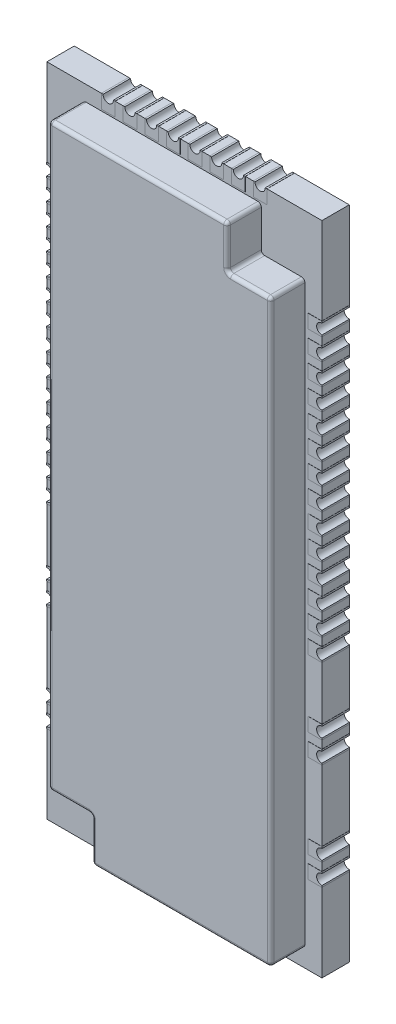
from build123d import *

# Parameters (mm, degrees)
ESQUISSE1_W                          = 16.1
ESQUISSE1_H                          = 38.4
BOSS_EXTRU_1_DEPTH                   = 1.6
ESQUISSE7_W                          = 0.8
ESQUISSE7_H                          = 0.8
BOSS_EXTRU_4_DEPTH                   = 0.01
ESQUISSE9_W                          = 0.8
ESQUISSE9_H                          = 0.8
BOSS_EXTRU_6_DEPTH                   = 0.01
R_P_TITION_LIN_AIRE6_COUNT           = 8
R_P_TITION_LIN_AIRE6_PITCH           = 1.27
R_P_TITION_LIN_AIRE4_COUNT           = 14
R_P_TITION_LIN_AIRE4_PITCH           = 1.27
R_P_TITION_LIN_AIRE4_COUNT_DIR2      = 2
R_P_TITION_LIN_AIRE4_PITCH_DIR2      = 15.3
ESQUISSE10_W                         = 0.800196755
ESQUISSE10_H                         = 1.574838598
BOSS_EXTRU_7_DEPTH                   = 0.01
R_P_TITION_LIN_AIRE7_COUNT           = 8
R_P_TITION_LIN_AIRE7_PITCH           = 1.27
ESQUISSE8_W                          = 1.61
ESQUISSE8_H                          = 0.799843022
BOSS_EXTRU_5_DEPTH                   = 0.01
R_P_TITION_LIN_AIRE5_COUNT           = 14
R_P_TITION_LIN_AIRE5_PITCH           = 1.27
R_P_TITION_LIN_AIRE5_COUNT_DIR2      = 2
R_P_TITION_LIN_AIRE5_PITCH_DIR2      = 16.11
ESQUISSE11_W                         = 0.8
ESQUISSE11_H                         = 0.8
BOSS_EXTRU_8_DEPTH                   = 0.01
ESQUISSE12_W                         = 1.61
ESQUISSE12_H                         = 0.8
BOSS_EXTRU_9_DEPTH                   = 0.01
R_P_TITION_LIN_AIRE8_COUNT           = 2
R_P_TITION_LIN_AIRE8_PITCH           = 1.27
R_P_TITION_LIN_AIRE8_COUNT_DIR2      = 2
R_P_TITION_LIN_AIRE8_PITCH_DIR2      = 16.11
R_P_TITION_LIN_AIRE9_COPY_1_SKETCH_W = 1.61
R_P_TITION_LIN_AIRE9_COPY_1_SKETCH_H = 0.8
R_P_TITION_LIN_AIRE9_COPY_1_DEPTH    = 0.01
R_P_TITION_LIN_AIRE9_COPY_2_SKETCH_W = 1.61
R_P_TITION_LIN_AIRE9_COPY_2_SKETCH_H = 0.8
R_P_TITION_LIN_AIRE9_COPY_2_DEPTH    = 0.01
R_P_TITION_LIN_AIRE9_COPY_3_SKETCH_W = 1.61
R_P_TITION_LIN_AIRE9_COPY_3_SKETCH_H = 0.8
R_P_TITION_LIN_AIRE9_COPY_3_DEPTH    = 0.01
R_P_TITION_LIN_AIRE9_COPY_4_SKETCH_W = 1.61
R_P_TITION_LIN_AIRE9_COPY_4_SKETCH_H = 0.8
R_P_TITION_LIN_AIRE9_COPY_4_DEPTH    = 0.01
ENL_V_START                          = -1.6
ESQUISSE2_R                          = 0.3
ENL_V_MAT_EXTRU_1_DEPTH              = 1.7
R_P_TITION_LIN_AIRE10_COUNT          = 2
R_P_TITION_LIN_AIRE10_PITCH          = 15.3
R_P_TITION_LIN_AIRE1_COUNT           = 14
R_P_TITION_LIN_AIRE1_PITCH           = 16.1
ESQUISSE3_R                          = 0.3
ENL_V_MAT_EXTRU_2_DEPTH              = 1.7
R_P_TITION_LIN_AIRE2_COUNT           = 2
R_P_TITION_LIN_AIRE2_PITCH           = 16.1
R_P_TITION_LIN_AIRE2_COUNT_DIR2      = 14
R_P_TITION_LIN_AIRE2_PITCH_DIR2      = 1.27
ESQUISSE4_R                          = 0.3
ENL_V_MAT_EXTRU_3_DEPTH              = 1.7
R_P_TITION_LIN_AIRE3_COUNT           = 8
R_P_TITION_LIN_AIRE3_PITCH           = 1.27
ESQUISSE5_W                          = 13
ESQUISSE5_H                          = 36.5
BOSS_EXTRU_2_DEPTH                   = 2
ESQUISSE6_W                          = 2.55
ESQUISSE6_H                          = 2.55
ENL_V_MAT_EXTRU_4_DEPTH              = 2
CONG_1_R                             = 0.2


with BuildPart() as part:
    # Esquisse1 → Boss.-Extru.1 (new body)
    with BuildSketch(Plane.XY):
        with Locations((8.05, 19.2)):
            Rectangle(ESQUISSE1_W, ESQUISSE1_H)
    extrude(amount=BOSS_EXTRU_1_DEPTH)

    # Esquisse7 → Boss.-Extru.4 (add)
    with BuildSketch(Plane.XY.offset(1.6)):
        with Locations((15.7, 32.91)):
            Rectangle(ESQUISSE7_W, ESQUISSE7_H)
    boss_extru_4 = extrude(amount=BOSS_EXTRU_4_DEPTH)

    # Esquisse9 → Boss.-Extru.6 (add)
    with BuildSketch(Plane.XY.offset(1.6)):
        with Locations((12.49, 38)):
            Rectangle(ESQUISSE9_W, ESQUISSE9_H)
    boss_extru_6 = extrude(amount=BOSS_EXTRU_6_DEPTH)

    # Répétition linéaire6: Boss.-Extru.6 ×8
    with Locations(*[(-i * R_P_TITION_LIN_AIRE6_PITCH, 0, 0) for i in range(1, R_P_TITION_LIN_AIRE6_COUNT)]):
        add(boss_extru_6)

    # Répétition linéaire4: Boss.-Extru.4 14 × 2
    with Locations(*[(-j * R_P_TITION_LIN_AIRE4_PITCH_DIR2, -i * R_P_TITION_LIN_AIRE4_PITCH, 0) for i in range(R_P_TITION_LIN_AIRE4_COUNT) for j in range(R_P_TITION_LIN_AIRE4_COUNT_DIR2) if (i, j) != (0, 0)]):
        add(boss_extru_4)

    # Esquisse10 → Boss.-Extru.7 (add)
    with BuildSketch(Plane(origin=(0, 38.4, 0), x_dir=(1, 0, 0), z_dir=(0, 1, 0))):
        with Locations((12.489901622, -0.822580701)):
            Rectangle(ESQUISSE10_W, ESQUISSE10_H)
    boss_extru_7 = extrude(amount=BOSS_EXTRU_7_DEPTH)

    # Répétition linéaire7: Boss.-Extru.7 ×8
    with Locations(*[(-i * R_P_TITION_LIN_AIRE7_PITCH, 0, 0) for i in range(1, R_P_TITION_LIN_AIRE7_COUNT)]):
        add(boss_extru_7)

    # Esquisse8 → Boss.-Extru.5 (add)
    with BuildSketch(Plane.ZY):
        with Locations((0.805, 32.910078489)):
            Rectangle(ESQUISSE8_W, ESQUISSE8_H)
    boss_extru_5 = extrude(amount=BOSS_EXTRU_5_DEPTH)

    # Répétition linéaire5: Boss.-Extru.5 14 × 2
    with Locations(*[(j * R_P_TITION_LIN_AIRE5_PITCH_DIR2, -i * R_P_TITION_LIN_AIRE5_PITCH, 0) for i in range(R_P_TITION_LIN_AIRE5_COUNT) for j in range(R_P_TITION_LIN_AIRE5_COUNT_DIR2) if (i, j) != (0, 0)]):
        add(boss_extru_5)

    # Esquisse11 → Boss.-Extru.8 (add)
    with BuildSketch(Plane.XY.offset(1.6)):
        with Locations((0.4, 12.47)):
            Rectangle(ESQUISSE11_W, ESQUISSE11_H)
        with Locations((0.4, 11.2)):
            Rectangle(ESQUISSE11_W, ESQUISSE11_H)
        with Locations((0.4, 6.27)):
            Rectangle(ESQUISSE11_W, ESQUISSE11_H)
        with Locations((0.4, 5)):
            Rectangle(ESQUISSE11_W, ESQUISSE11_H)
    boss_extru_8 = extrude(amount=BOSS_EXTRU_8_DEPTH)

    # Esquisse12 → Boss.-Extru.9 (add)
    with BuildSketch(Plane.ZY):
        with Locations((0.805, 12.47)):
            Rectangle(ESQUISSE12_W, ESQUISSE12_H)
    boss_extru_9 = extrude(amount=BOSS_EXTRU_9_DEPTH)

    # Répétition linéaire8: Boss.-Extru.9 2 × 2
    with Locations(*[(j * R_P_TITION_LIN_AIRE8_PITCH_DIR2, -i * R_P_TITION_LIN_AIRE8_PITCH, 0) for i in range(R_P_TITION_LIN_AIRE8_COUNT) for j in range(R_P_TITION_LIN_AIRE8_COUNT_DIR2) if (i, j) != (0, 0)]):
        add(boss_extru_9)

    # Répétition linéaire9 copy 1 sketch → Répétition linéaire9 copy 1 (add)
    with BuildSketch(Plane(origin=(16.11, -6.2, 0), x_dir=(0, 0, 1), z_dir=(-1, 0, 0))):
        with Locations((0.805, 12.47)):
            Rectangle(R_P_TITION_LIN_AIRE9_COPY_1_SKETCH_W, R_P_TITION_LIN_AIRE9_COPY_1_SKETCH_H)
    extrude(amount=R_P_TITION_LIN_AIRE9_COPY_1_DEPTH)

    # Répétition linéaire9 copy 2 sketch → Répétition linéaire9 copy 2 (add)
    with BuildSketch(Plane(origin=(0, -7.47, 0), x_dir=(0, 0, 1), z_dir=(-1, 0, 0))):
        with Locations((0.805, 12.47)):
            Rectangle(R_P_TITION_LIN_AIRE9_COPY_2_SKETCH_W, R_P_TITION_LIN_AIRE9_COPY_2_SKETCH_H)
    extrude(amount=R_P_TITION_LIN_AIRE9_COPY_2_DEPTH)

    # Répétition linéaire9 copy 3 sketch → Répétition linéaire9 copy 3 (add)
    with BuildSketch(Plane(origin=(16.11, -7.47, 0), x_dir=(0, 0, 1), z_dir=(-1, 0, 0))):
        with Locations((0.805, 12.47)):
            Rectangle(R_P_TITION_LIN_AIRE9_COPY_3_SKETCH_W, R_P_TITION_LIN_AIRE9_COPY_3_SKETCH_H)
    extrude(amount=R_P_TITION_LIN_AIRE9_COPY_3_DEPTH)

    # Répétition linéaire9 copy 4 sketch → Répétition linéaire9 copy 4 (add)
    with BuildSketch(Plane(origin=(0, -6.2, 0), x_dir=(0, 0, 1), z_dir=(-1, 0, 0))):
        with Locations((0.805, 12.47)):
            Rectangle(R_P_TITION_LIN_AIRE9_COPY_4_SKETCH_W, R_P_TITION_LIN_AIRE9_COPY_4_SKETCH_H)
    extrude(amount=R_P_TITION_LIN_AIRE9_COPY_4_DEPTH)

    # Esquisse2 → Enlèv. mat.-Extru.1 (cut)
    with BuildSketch(Plane.XY.offset(1.6).offset(ENL_V_START)):
        with Locations((0, 5)):
            Circle(ESQUISSE2_R)
        with Locations((0, 6.27)):
            Circle(ESQUISSE2_R)
        with Locations((0, 11.2)):
            Circle(ESQUISSE2_R)
        with Locations((0, 12.47)):
            Circle(ESQUISSE2_R)
    enl_v_mat_extru_1 = extrude(amount=ENL_V_MAT_EXTRU_1_DEPTH, mode=Mode.SUBTRACT)

    # Répétition linéaire10: Boss.-Extru.8 ×2
    with Locations(*[(i * R_P_TITION_LIN_AIRE10_PITCH, 0, 0) for i in range(1, R_P_TITION_LIN_AIRE10_COUNT)]):
        add(boss_extru_8)

    # Répétition linéaire1: Enlèv. mat.-Extru.1 ×14
    with Locations(*[(i * R_P_TITION_LIN_AIRE1_PITCH, 0, 0) for i in range(1, R_P_TITION_LIN_AIRE1_COUNT)]):
        add(enl_v_mat_extru_1, mode=Mode.SUBTRACT)

    # Esquisse3 → Enlèv. mat.-Extru.2 (cut)
    with BuildSketch(Plane.XY.offset(1.6).offset(ENL_V_START)):
        with Locations((0, 16.4)):
            Circle(ESQUISSE3_R)
    enl_v_mat_extru_2 = extrude(amount=ENL_V_MAT_EXTRU_2_DEPTH, mode=Mode.SUBTRACT)

    # Répétition linéaire2: Enl_v. mat.-Extru.2 2 × 14
    with Locations(*[(i * R_P_TITION_LIN_AIRE2_PITCH, j * R_P_TITION_LIN_AIRE2_PITCH_DIR2, 0) for i in range(R_P_TITION_LIN_AIRE2_COUNT) for j in range(R_P_TITION_LIN_AIRE2_COUNT_DIR2) if (i, j) != (0, 0)]):
        add(enl_v_mat_extru_2, mode=Mode.SUBTRACT)

    # Esquisse4 → Enlèv. mat.-Extru.3 (cut)
    with BuildSketch(Plane.XY.offset(1.6).offset(ENL_V_START)):
        with Locations((3.6, 38.4)):
            Circle(ESQUISSE4_R)
    enl_v_mat_extru_3 = extrude(amount=ENL_V_MAT_EXTRU_3_DEPTH, mode=Mode.SUBTRACT)

    # Répétition linéaire3: Enlèv. mat.-Extru.3 ×8
    with Locations(*[(i * R_P_TITION_LIN_AIRE3_PITCH, 0, 0) for i in range(1, R_P_TITION_LIN_AIRE3_COUNT)]):
        add(enl_v_mat_extru_3, mode=Mode.SUBTRACT)

    # Esquisse5 → Boss.-Extru.2 (add)
    with BuildSketch(Plane.XY.offset(1.6)):
        with Locations((8.6, 19.25)):
            Rectangle(ESQUISSE5_W, ESQUISSE5_H)
    extrude(amount=BOSS_EXTRU_2_DEPTH)

    # Esquisse6 → Enlèv. mat.-Extru.4 (cut)
    with BuildSketch(Plane.XY.offset(3.6)):
        with Locations((3.375, 2.275)):
            Rectangle(ESQUISSE6_W, ESQUISSE6_H)
        with Locations((13.825, 36.225)):
            Rectangle(ESQUISSE6_W, ESQUISSE6_H)
    extrude(amount=-ENL_V_MAT_EXTRU_4_DEPTH, mode=Mode.SUBTRACT)

    # Congé1
    cong_1_edges = [part.edges().sort_by_distance(p)[0] for p in [
        (2.1, 20.525, 3.6),
        (7.325, 37.5, 3.6),
        (12.55, 36.225, 3.6),
        (13.825, 34.95, 3.6),
        (15.1, 17.975, 3.6),
        (9.875, 1, 3.6),
        (4.65, 2.275, 3.6),
        (3.375, 3.55, 3.6),
        (2.1, 37.5, 2.6),
        (12.55, 37.5, 2.6),
        (12.55, 34.95, 2.6),
        (15.1, 34.95, 2.6),
        (15.1, 1, 2.6),
        (4.65, 1, 2.6),
        (4.65, 3.55, 2.6),
        (2.1, 3.55, 2.6),
    ]]
    fillet(cong_1_edges, radius=CONG_1_R)


solid = part.part
